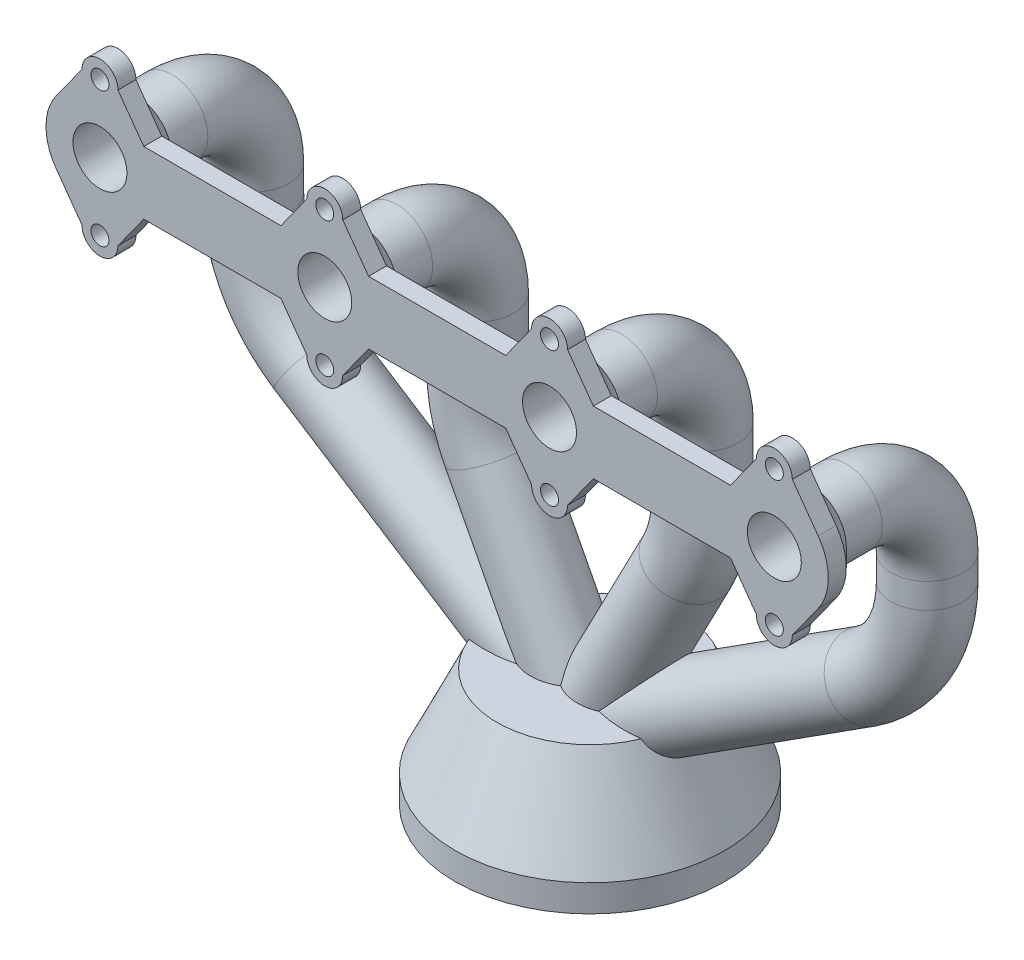
from build123d import *

# Parameters (mm, degrees)
SKETCH2_R            = 5
BOSS_EXTRUDE1_DEPTH  = 10
SWEEP1_PROFILE_R     = 20
CUT_SWEEP1_PROFILE_R = 15
SKETCH16_W           = 10
SKETCH16_H           = 11.049002711
EXTRUDE_THIN1_DEPTH  = 10
CHAMFER1_SIZE        = 10


with BuildPart() as part:
    # Sketch1 → Revolve1 (revolve)
    with BuildSketch(Plane.XY, mode=Mode.PRIVATE) as revolve1_sk:
        Polygon((-75, 0), (-75, 15), (-51.684617092, 65), (0, 65), (0, 0), align=None)
    revolve(revolve1_sk.sketch.rotate(Axis((0, 0, 0), (0, -1, 0)), 270), axis=Axis((0, 0, 0), (0, -1, 0)))



with BuildPart() as body_2:
    # Sketch2 → Boss-Extrude1 (new body)
    # profile 1 of 13: a face of its own
    with BuildSketch(Plane.XY.offset(85)):
        with BuildLine():
            ThreePointArc((163.134912818, 277.502643418), (163.133014212, 277.500000103), (163.131115892, 277.497356582))
            Line((163.131115892, 277.497356582), (187.5, 277.497356582))
            Line((187.5, 277.497356582), (187.5, 242.497356582))
            Line((187.5, 242.497356582), (163.134912818, 242.497356582))
            Line((163.134912818, 242.497356582), (177.5, 222.5))
            ThreePointArc((177.5, 222.5), (187.5, 212.5), (197.5, 222.5))
            Line((197.5, 222.5), (211.865087182, 242.497356582))
            ThreePointArc((211.865087182, 242.497356582), (217.5, 260), (211.865087182, 277.502643418))
            Line((211.865087182, 277.502643418), (197.5, 297.5))
            ThreePointArc((197.5, 297.5), (187.5, 307.5), (177.5, 297.5))
            Line((177.5, 297.5), (163.134912818, 277.502643418))
        make_face()
        with Locations((187.5, 222.5)):
            Circle(SKETCH2_R, mode=Mode.SUBTRACT)
        with Locations((187.5, 297.5)):
            Circle(SKETCH2_R, mode=Mode.SUBTRACT)
    # profile 2 of 13: a face of its own
    with BuildSketch(Plane.XY.offset(85)):
        with BuildLine():
            Line((187.5, 277.497356582), (163.131115892, 277.497356582))
            ThreePointArc((163.131115892, 277.497356582), (157.500000177, 259.996745492), (163.134912818, 242.497356582))
            Line((163.134912818, 242.497356582), (187.5, 242.497356582))
            Line((187.5, 242.497356582), (187.5, 277.497356582))
        make_face()
    # profile 3 of 13: a face of its own
    with BuildSketch(Plane.XY.offset(85)):
        with BuildLine():
            Line((163.131115892, 277.497356582), (86.868884108, 277.497356582))
            ThreePointArc((86.868884108, 277.497356582), (92.499999823, 259.996745492), (86.865087182, 242.497356582))
            Line((86.865087182, 242.497356582), (163.134912818, 242.497356582))
            ThreePointArc((163.134912818, 242.497356582), (157.500000177, 259.996745492), (163.131115892, 277.497356582))
        make_face()
    # profile 4 of 13: a face of its own
    with BuildSketch(Plane.XY.offset(85)):
        with BuildLine():
            Line((86.868884108, 277.497356582), (38.131115892, 277.497356582))
            ThreePointArc((38.131115892, 277.497356582), (32.500000177, 259.996745492), (38.134912818, 242.497356582))
            Line((38.134912818, 242.497356582), (86.865087182, 242.497356582))
            ThreePointArc((86.865087182, 242.497356582), (92.499999823, 259.996745492), (86.868884108, 277.497356582))
        make_face()
    # profile 5 of 13: a face of its own
    with BuildSketch(Plane.XY.offset(85)):
        with BuildLine():
            ThreePointArc((38.134912818, 277.502643418), (38.133014212, 277.500000103), (38.131115892, 277.497356582))
            Line((38.131115892, 277.497356582), (86.868884108, 277.497356582))
            ThreePointArc((86.868884108, 277.497356582), (86.866985788, 277.500000103), (86.865087182, 277.502643418))
            Line((86.865087182, 277.502643418), (72.5, 297.5))
            ThreePointArc((72.5, 297.5), (62.5, 307.5), (52.5, 297.5))
            Line((52.5, 297.5), (38.134912818, 277.502643418))
        make_face()
        with Locations((62.5, 297.5)):
            Circle(SKETCH2_R, mode=Mode.SUBTRACT)
    # profile 6 of 13: a face of its own
    with BuildSketch(Plane.XY.offset(85)):
        with BuildLine():
            Line((86.865087182, 242.497356582), (38.134912818, 242.497356582))
            Line((38.134912818, 242.497356582), (52.5, 222.5))
            ThreePointArc((52.5, 222.5), (62.5, 212.5), (72.5, 222.5))
            Line((72.5, 222.5), (86.865087182, 242.497356582))
        make_face()
        with Locations((62.5, 222.5)):
            Circle(SKETCH2_R, mode=Mode.SUBTRACT)
    # profile 7 of 13: a face of its own
    with BuildSketch(Plane.XY.offset(85)):
        with BuildLine():
            Line((38.131115892, 277.497356582), (-38.131115892, 277.497356582))
            ThreePointArc((-38.131115892, 277.497356582), (-32.500000177, 259.996745492), (-38.134912818, 242.497356582))
            Line((-38.134912818, 242.497356582), (38.134912818, 242.497356582))
            ThreePointArc((38.134912818, 242.497356582), (32.500000177, 259.996745492), (38.131115892, 277.497356582))
        make_face()
    # profile 8 of 13: a face of its own
    with BuildSketch(Plane.XY.offset(85)):
        with BuildLine():
            ThreePointArc((-86.865087182, 277.502643418), (-86.866985788, 277.500000103), (-86.868884108, 277.497356582))
            Line((-86.868884108, 277.497356582), (-38.131115892, 277.497356582))
            ThreePointArc((-38.131115892, 277.497356582), (-38.133014212, 277.500000103), (-38.134912818, 277.502643418))
            Line((-38.134912818, 277.502643418), (-52.5, 297.5))
            ThreePointArc((-52.5, 297.5), (-62.5, 307.5), (-72.5, 297.5))
            Line((-72.5, 297.5), (-86.865087182, 277.502643418))
        make_face()
        with Locations((-62.5, 297.5)):
            Circle(SKETCH2_R, mode=Mode.SUBTRACT)
    # profile 9 of 13: a face of its own
    with BuildSketch(Plane.XY.offset(85)):
        with BuildLine():
            Line((-38.131115892, 277.497356582), (-86.868884108, 277.497356582))
            ThreePointArc((-86.868884108, 277.497356582), (-92.499999823, 259.996745492), (-86.865087182, 242.497356582))
            Line((-86.865087182, 242.497356582), (-38.134912818, 242.497356582))
            ThreePointArc((-38.134912818, 242.497356582), (-32.500000177, 259.996745492), (-38.131115892, 277.497356582))
        make_face()
    # profile 10 of 13: a face of its own
    with BuildSketch(Plane.XY.offset(85)):
        with BuildLine():
            Line((-38.134912818, 242.497356582), (-86.865087182, 242.497356582))
            Line((-86.865087182, 242.497356582), (-72.5, 222.5))
            ThreePointArc((-72.5, 222.5), (-62.5, 212.5), (-52.5, 222.5))
            Line((-52.5, 222.5), (-38.134912818, 242.497356582))
        make_face()
        with Locations((-62.5, 222.5)):
            Circle(SKETCH2_R, mode=Mode.SUBTRACT)
    # profile 11 of 13: a face of its own
    with BuildSketch(Plane.XY.offset(85)):
        with BuildLine():
            Line((-86.868884108, 277.497356582), (-163.131115892, 277.497356582))
            ThreePointArc((-163.131115892, 277.497356582), (-157.500000177, 259.996745492), (-163.134912818, 242.497356582))
            Line((-163.134912818, 242.497356582), (-86.865087182, 242.497356582))
            ThreePointArc((-86.865087182, 242.497356582), (-92.499999823, 259.996745492), (-86.868884108, 277.497356582))
        make_face()
    # profile 12 of 13: a face of its own
    with BuildSketch(Plane.XY.offset(85)):
        with BuildLine():
            ThreePointArc((-163.134912818, 242.497356582), (-157.500000177, 259.996745492), (-163.131115892, 277.497356582))
            Line((-163.131115892, 277.497356582), (-187.5, 277.497356582))
            Line((-187.5, 277.497356582), (-187.5, 242.497356582))
            Line((-187.5, 242.497356582), (-163.134912818, 242.497356582))
        make_face()
    # profile 13 of 13: a face of its own
    with BuildSketch(Plane.XY.offset(85)):
        with BuildLine():
            ThreePointArc((-177.5, 297.5), (-187.5, 307.5), (-197.5, 297.5))
            Line((-197.5, 297.5), (-211.865087182, 277.502643418))
            ThreePointArc((-211.865087182, 277.502643418), (-217.5, 260), (-211.865087182, 242.497356582))
            Line((-211.865087182, 242.497356582), (-197.5, 222.5))
            ThreePointArc((-197.5, 222.5), (-187.5, 212.5), (-177.5, 222.5))
            Line((-177.5, 222.5), (-163.134912818, 242.497356582))
            Line((-163.134912818, 242.497356582), (-187.5, 242.497356582))
            Line((-187.5, 242.497356582), (-187.5, 277.497356582))
            Line((-187.5, 277.497356582), (-163.131115892, 277.497356582))
            ThreePointArc((-163.131115892, 277.497356582), (-163.133014212, 277.500000103), (-163.134912818, 277.502643418))
            Line((-163.134912818, 277.502643418), (-177.5, 297.5))
        make_face()
        with Locations((-187.5, 222.5)):
            Circle(SKETCH2_R, mode=Mode.SUBTRACT)
        with Locations((-187.5, 297.5)):
            Circle(SKETCH2_R, mode=Mode.SUBTRACT)
    extrude(amount=-BOSS_EXTRUDE1_DEPTH)


with BuildPart() as part_1:
    add(part.part)

    add(body_2.part)  # Sweep1 merges body 2
    # Sweep1: sweep along a curve in space
    with BuildLine() as sweep1_path:
        Line((62.5, 260, 85), (62.5, 260, 45))
        ThreePointArc((62.5, 260, 45), (62.5, 246.819805153, 13.180194847), (62.5, 215, 0))
        Line((62.5, 215, 0), (62.5, 178.360709533, 0))
        ThreePointArc((62.5, 178.360709533, 0), (60.348787648, 160.526637135, 0), (54.018556313, 143.71562812, 0))
        Line((54.018556313, 143.71562812, 0), (0, 40, 0))
        Line((0, 40, 0), (152.929027232, 137.874577428, 0))
        ThreePointArc((152.929027232, 137.874577428, 0), (178.292009554, 165.039217948, 0), (187.5, 201.044932478, 0))
        Line((187.5, 201.044932478, 0), (187.5, 215, 0))
        ThreePointArc((187.5, 215, 0), (187.5, 246.819805153, 13.180194847), (187.5, 260, 45))
        Line((187.5, 260, 45), (187.5, 260, 85))
    # Sweep1 profile (on start of the path) → Sweep1 (sweep)
    with BuildSketch(Plane(origin=(62.5, 260, 85), x_dir=(-1, 0, 0), z_dir=(0, 0, -1))):
        Circle(SWEEP1_PROFILE_R)
    sweep1 = sweep(path=sweep1_path.line, transition=Transition.RIGHT)

    # Mirror1: Sweep1 across plane
    add(sweep1.mirror(Plane(origin=(0, 0, 0), x_dir=(0, 0, 1), z_dir=(1, 0, 0))))

    # Sketch10 → Cut-Revolve1 (revolve, cut)
    with BuildSketch(Plane.XY, mode=Mode.PRIVATE) as cut_revolve1_sk:
        Polygon((-65, 0), (-65, 12.783053374), (-45.313914484, 55), (0, 55), (0, 0), align=None)
    revolve(cut_revolve1_sk.sketch.rotate(Axis((0, 0, 0), (0, -1, 0)), 270), axis=Axis((0, 0, 0), (0, -1, 0)), mode=Mode.SUBTRACT)


with BuildPart() as cut_revolve1_piece_1:
    # of the separate pieces the step leaves, piece 1, a body of its own (cut_revolve1_pieces)
    add(part_1.part.solids().sort_by_distance((0, 0, 75))[0])

    # Cut-Sweep1: sweep along a curve in space
    with BuildLine() as cut_sweep1_path:
        Line((62.5, 260, 85), (62.5, 260, 45))
        ThreePointArc((62.5, 260, 45), (62.5, 246.819805153, 13.180194847), (62.5, 215, 0))
        Line((62.5, 215, 0), (62.5, 178.360709533, 0))
        ThreePointArc((62.5, 178.360709533, 0), (60.348787648, 160.526637135, 0), (54.018556313, 143.71562812, 0))
        Line((54.018556313, 143.71562812, 0), (0, 40, 0))
        Line((0, 40, 0), (152.929027232, 137.874577428, 0))
        ThreePointArc((152.929027232, 137.874577428, 0), (178.292009554, 165.039217948, 0), (187.5, 201.044932478, 0))
        Line((187.5, 201.044932478, 0), (187.5, 215, 0))
        ThreePointArc((187.5, 215, 0), (187.5, 246.819805153, 13.180194847), (187.5, 260, 45))
        Line((187.5, 260, 45), (187.5, 260, 85))
    # Cut-Sweep1 profile (on start of the path) → Cut-Sweep1 (sweep, cut)
    with BuildSketch(Plane(origin=(62.5, 260, 85), x_dir=(-1, 0, 0), z_dir=(0, 0, -1))):
        Circle(CUT_SWEEP1_PROFILE_R)
    cut_sweep1 = sweep(path=cut_sweep1_path.line, transition=Transition.RIGHT, mode=Mode.SUBTRACT)

    # Mirror2: Cut-Sweep1 across plane
    add(cut_sweep1.mirror(Plane(origin=(0, 0, 0), x_dir=(0, 0, 1), z_dir=(1, 0, 0))), mode=Mode.SUBTRACT)

    # Chamfer1
    chamfer1_edges = [cut_revolve1_piece_1.edges().sort_by_distance(p)[0] for p in [
        (82.5, 260, 75),
        (167.5, 260, 75),
        (-82.5, 260, 75),
        (-167.5, 260, 75),
    ]]
    chamfer(chamfer1_edges, length=CHAMFER1_SIZE - 0.0001)  # a hair under: the kernel refuses the full size


with BuildPart() as cut_revolve1_piece_2:
    # of the separate pieces the step leaves, piece 2, a body of its own (cut_revolve1_pieces)
    add(part_1.part.solids().sort_by_distance((-36.584440048, 0, 14.312319793))[0])


with BuildPart() as cut_revolve1_piece_3:
    # of the separate pieces the step leaves, piece 3, a body of its own (cut_revolve1_pieces)
    add(part_1.part.solids().sort_by_distance((52.376175419, -17.266067596, 0))[0])


with BuildPart() as body_4:
    # Sketch16 → Extrude-Thin1 (new body)
    with BuildSketch(Plane(origin=(0, 0, 0), x_dir=(1, 0, 0), z_dir=(0, 1, 0))):
        with Locations((-17.5, 79.475498644)):
            Rectangle(SKETCH16_W, SKETCH16_H)
    extrude(amount=EXTRUDE_THIN1_DEPTH)


solid = Compound([cut_revolve1_piece_1.part, cut_revolve1_piece_2.part, cut_revolve1_piece_3.part, body_4.part])
